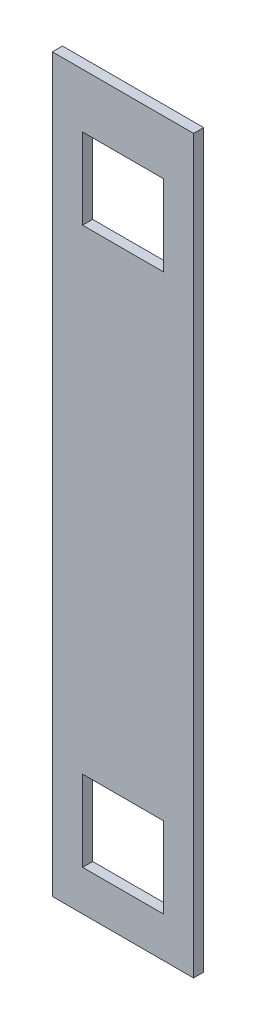
from build123d import *

# Parameters (mm, degrees)
SKETCH1_W           = 177.8
SKETCH1_H           = 920.75
BOSS_EXTRUDE1_DEPTH = 12.7
CUT_EXTRUDE1_REACH  = 471.052
SKETCH2_W           = 101.6
SKETCH2_H           = 101.6


with BuildPart() as part:
    # Sketch1 → Boss-Extrude1 (new body)
    with BuildSketch(Plane.XY):
        Rectangle(SKETCH1_W, SKETCH1_H)
    extrude(amount=BOSS_EXTRUDE1_DEPTH)

    # Sketch2 → Cut-Extrude1 (cut, up to next)
    with BuildSketch(Plane(origin=(0, 0, 0), x_dir=(-1, 0, 0), z_dir=(0, 0, -1)), mode=Mode.PRIVATE) as cut_extrude1_sk1:
        with Locations((0, -358.775)):
            Rectangle(SKETCH2_W, SKETCH2_H)
    cut_extrude1_tool1 = extrude(cut_extrude1_sk1.sketch, amount=-CUT_EXTRUDE1_REACH, mode=Mode.PRIVATE) & part.part
    # Sketch2 → Cut-Extrude1 (cut, up to next)
    with BuildSketch(Plane(origin=(0, 0, 0), x_dir=(-1, 0, 0), z_dir=(0, 0, -1)), mode=Mode.PRIVATE) as cut_extrude1_sk2:
        with Locations((0, 341.225)):
            Rectangle(SKETCH2_W, SKETCH2_H)
    cut_extrude1_tool2 = extrude(cut_extrude1_sk2.sketch, amount=-CUT_EXTRUDE1_REACH, mode=Mode.PRIVATE) & part.part
    add(cut_extrude1_tool1.solids().sort_by_distance((0, -358.775, 0))[0], mode=Mode.SUBTRACT)
    add(cut_extrude1_tool2.solids().sort_by_distance((0, 341.225, 0))[0], mode=Mode.SUBTRACT)


solid = part.part
